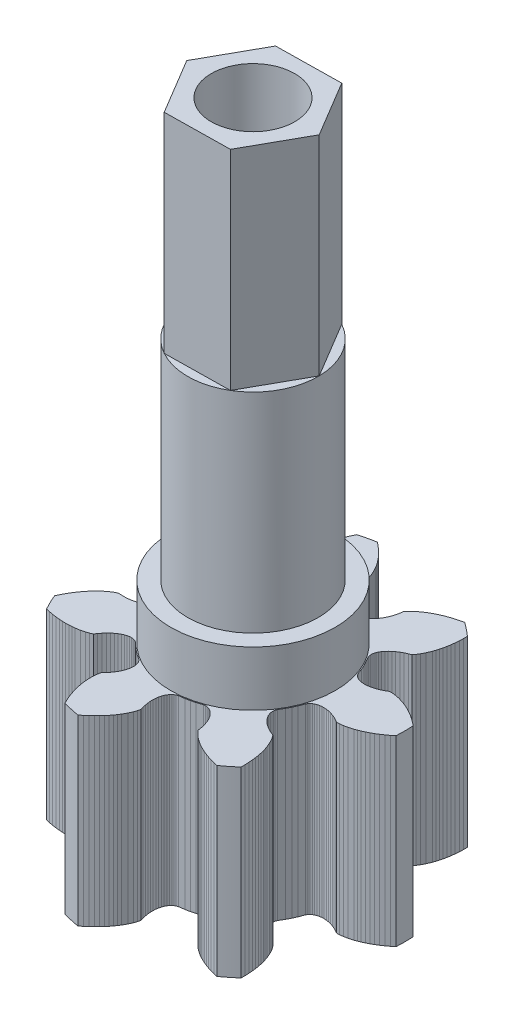
from build123d import *

# Parameters (mm, degrees)
SKETCH1_R           = 3.15
BOSS_EXTRUDE1_DEPTH = 2.1
SKETCH2_R           = 2.5
BOSS_EXTRUDE3_DEPTH = 16
BOSS_EXTRUDE4_DEPTH = 7
SKETCH3_R           = 1.1
SKETCH3_R_2         = 0.75
CUT_EXTRUDE2_DEPTH  = 20.858328167
SKETCH6_R           = 1.7
CUT_EXTRUDE3_DEPTH  = 7.6
SKETCH7_R           = 1.6
CUT_EXTRUDE4_DEPTH  = 20.313031807
SKETCH8_OUTSIDE_W   = 19.149
SKETCH8_OUTSIDE_H   = 19.428
CUT_EXTRUDE5_DEPTH  = 8


with BuildPart() as part:
    # Sketch1 → Boss-Extrude1 (new body)
    with BuildSketch(Plane(origin=(0, 0, 0), x_dir=(1, 0, 0), z_dir=(0, 1, 0))):
        with Locations(Location((0, 0, 0), (0, 0, 270))):
            Circle(SKETCH1_R)
    extrude(amount=BOSS_EXTRUDE1_DEPTH)

    # Sketch2 → Boss-Extrude3 (add)
    with BuildSketch(Plane(origin=(0, 2.1, 0), x_dir=(1, 0, 0), z_dir=(0, 1, 0))):
        with Locations(Location((0, 0, 0), (0, 0, 270))):
            Circle(SKETCH2_R)
    extrude(amount=BOSS_EXTRUDE3_DEPTH)

    # Sketch4 → Boss-Extrude4 (add)
    with BuildSketch(Plane.XZ):
        with BuildLine():
            Line((-1.677656104, -5.457545802), (-1.740166904, -5.314388502))
            Line((-1.740166904, -5.314388502), (-1.793915704, -5.175673402))
            Line((-1.793915704, -5.175673402), (-1.839244704, -5.042342702))
            Line((-1.839244704, -5.042342702), (-1.876421604, -4.915999102))
            Line((-1.876421604, -4.915999102), (-1.907053904, -4.793237402))
            Line((-1.907053904, -4.793237402), (-1.931099704, -4.676009702))
            Line((-1.931099704, -4.676009702), (-1.948773704, -4.566830802))
            Line((-1.948773704, -4.566830802), (-1.961024804, -4.464035702))
            Line((-1.961024804, -4.464035702), (-1.971502404, -4.279785302))
            Line((-1.971502404, -4.279785302), (-1.967365804, -4.124635702))
            Line((-1.967365804, -4.124635702), (-1.953730504, -4.000928102))
            Line((-1.953730504, -4.000928102), (-1.930260404, -3.886700602))
            Line((-1.930260404, -3.886700602), (-1.859391804, -3.809735002))
            Line((-1.859391804, -3.809735002), (-1.778417204, -3.712510502))
            Line((-1.778417204, -3.712510502), (-1.708697804, -3.615493902))
            Line((-1.708697804, -3.615493902), (-1.650076104, -3.519450202))
            Line((-1.650076104, -3.519450202), (-1.602332404, -3.425130202))
            Line((-1.602332404, -3.425130202), (-1.565200104, -3.333258302))
            Line((-1.565200104, -3.333258302), (-1.538382904, -3.244569502))
            Line((-1.538382904, -3.244569502), (-1.521548504, -3.159737902))
            Line((-1.521548504, -3.159737902), (-1.514299404, -3.079451802))
            Line((-1.514299404, -3.079451802), (-1.516222204, -3.004347502))
            Line((-1.516222204, -3.004347502), (-1.526863004, -2.935043002))
            Line((-1.526863004, -2.935043002), (-1.545721204, -2.872129302))
            Line((-1.545721204, -2.872129302), (-1.572279104, -2.816160102))
            Line((-1.572279104, -2.816160102), (-1.605971904, -2.767662302))
            Line((-1.605971904, -2.767662302), (-1.657232504, -2.718290402))
            Line((-1.657232504, -2.718290402), (-1.844744204, -2.592775302))
            Line((-1.844744204, -2.592775302), (-1.984007204, -2.487817902))
            Line((-1.984007204, -2.487817902), (-2.117322004, -2.375401802))
            Line((-2.117322004, -2.375401802), (-2.281415504, -2.220521102))
            Line((-2.281415504, -2.220521102), (-2.340956004, -2.181532002))
            Line((-2.340956004, -2.181532002), (-2.395735304, -2.159475702))
            Line((-2.395735304, -2.159475702), (-2.456210904, -2.146038102))
            Line((-2.456210904, -2.146038102), (-2.521743604, -2.141652302))
            Line((-2.521743604, -2.141652302), (-2.591678304, -2.146699902))
            Line((-2.591678304, -2.146699902), (-2.665327304, -2.161537602))
            Line((-2.665327304, -2.161537602), (-2.741987504, -2.186470302))
            Line((-2.741987504, -2.186470302), (-2.820946104, -2.221759402))
            Line((-2.820946104, -2.221759402), (-2.901443904, -2.267639402))
            Line((-2.901443904, -2.267639402), (-2.982749704, -2.324284202))
            Line((-2.982749704, -2.324284202), (-3.064080904, -2.391819002))
            Line((-3.064080904, -2.391819002), (-3.144672004, -2.470342602))
            Line((-3.144672004, -2.470342602), (-3.223742204, -2.559902302))
            Line((-3.223742204, -2.559902302), (-3.300510504, -2.660481102))
            Line((-3.300510504, -2.660481102), (-3.359776704, -2.746699402))
            Line((-3.359776704, -2.746699402), (-3.465917704, -2.794999002))
            Line((-3.465917704, -2.794999002), (-3.583489604, -2.835820002))
            Line((-3.583489604, -2.835820002), (-3.733828804, -2.874377002))
            Line((-3.733828804, -2.874377002), (-3.915791104, -2.905161502))
            Line((-3.915791104, -2.905161502), (-4.018735004, -2.916091602))
            Line((-4.018735004, -2.916091602), (-4.129109504, -2.923155402))
            Line((-4.129109504, -2.923155402), (-4.248748704, -2.925798102))
            Line((-4.248748704, -2.925798102), (-4.375248804, -2.923250802))
            Line((-4.375248804, -2.923250802), (-4.506697404, -2.915120202))
            Line((-4.506697404, -2.915120202), (-4.646771904, -2.900596502))
            Line((-4.646771904, -2.900596502), (-4.793969404, -2.879062302))
            Line((-4.793969404, -2.879062302), (-4.947447304, -2.849974302))
            Line((-4.947447304, -2.849974302), (-5.090225304, -2.816749202))
            ThreePointArc((-5.090225304, -2.816749202), (-5.241476502, -2.524161997), (-5.375926806, -2.223483907))
            Line((-5.375926806, -2.223483907), (-5.312882596, -2.091140098))
            Line((-5.312882596, -2.091140098), (-5.239932596, -1.953010098))
            Line((-5.239932596, -1.953010098), (-5.164992596, -1.824500098))
            Line((-5.164992596, -1.824500098), (-5.089012596, -1.705930098))
            Line((-5.089012596, -1.705930098), (-5.013412596, -1.598090098))
            Line((-5.013412596, -1.598090098), (-4.936532596, -1.497600098))
            Line((-4.936532596, -1.497600098), (-4.859872596, -1.405710098))
            Line((-4.859872596, -1.405710098), (-4.785532596, -1.323820098))
            Line((-4.785532596, -1.323820098), (-4.712802596, -1.250150098))
            Line((-4.712802596, -1.250150098), (-4.575282596, -1.127080098))
            Line((-4.575282596, -1.127080098), (-4.451402596, -1.033580098))
            Line((-4.451402596, -1.033580098), (-4.346182596, -0.967110098))
            Line((-4.346182596, -0.967110098), (-4.242242596, -0.914240098))
            Line((-4.242242596, -0.914240098), (-4.137882596, -0.921660098))
            Line((-4.137882596, -0.921660098), (-4.011382596, -0.924350098))
            Line((-4.011382596, -0.924350098), (-3.892062596, -0.918370098))
            Line((-3.892062596, -0.918370098), (-3.780422596, -0.904320098))
            Line((-3.780422596, -0.904320098), (-3.676912596, -0.882840098))
            Line((-3.676912596, -0.882840098), (-3.581932596, -0.854590098))
            Line((-3.581932596, -0.854590098), (-3.495872596, -0.820260098))
            Line((-3.495872596, -0.820260098), (-3.419052596, -0.780530098))
            Line((-3.419052596, -0.780530098), (-3.351762596, -0.736140098))
            Line((-3.351762596, -0.736140098), (-3.294242596, -0.687810098))
            Line((-3.294242596, -0.687810098), (-3.246692596, -0.636280098))
            Line((-3.246692596, -0.636280098), (-3.209262596, -0.582310098))
            Line((-3.209262596, -0.582310098), (-3.182062596, -0.526650098))
            Line((-3.182062596, -0.526650098), (-3.165152596, -0.470070098))
            Line((-3.165152596, -0.470070098), (-3.158512596, -0.399210098))
            Line((-3.158512596, -0.399210098), (-3.177292596, -0.174350098))
            Line((-3.177292596, -0.174350098), (-3.182062596, -3.0098e-05))
            Line((-3.182062596, -3.0098e-05), (-3.177292596, 0.174289902))
            Line((-3.177292596, 0.174289902), (-3.158512596, 0.399149902))
            Line((-3.158512596, 0.399149902), (-3.165152596, 0.470009902))
            Line((-3.165152596, 0.470009902), (-3.182062596, 0.526589902))
            Line((-3.182062596, 0.526589902), (-3.209262596, 0.582249902))
            Line((-3.209262596, 0.582249902), (-3.246692596, 0.636219902))
            Line((-3.246692596, 0.636219902), (-3.294242596, 0.687749902))
            Line((-3.294242596, 0.687749902), (-3.351762596, 0.736079902))
            Line((-3.351762596, 0.736079902), (-3.419052596, 0.780469902))
            Line((-3.419052596, 0.780469902), (-3.495872596, 0.820199902))
            Line((-3.495872596, 0.820199902), (-3.581932596, 0.854529902))
            Line((-3.581932596, 0.854529902), (-3.676912596, 0.882779902))
            Line((-3.676912596, 0.882779902), (-3.780422596, 0.904259902))
            Line((-3.780422596, 0.904259902), (-3.892062596, 0.918309902))
            Line((-3.892062596, 0.918309902), (-4.011382596, 0.924289902))
            Line((-4.011382596, 0.924289902), (-4.137882596, 0.921599902))
            Line((-4.137882596, 0.921599902), (-4.242242596, 0.914179902))
            Line((-4.242242596, 0.914179902), (-4.346182596, 0.967049902))
            Line((-4.346182596, 0.967049902), (-4.451402596, 1.033519902))
            Line((-4.451402596, 1.033519902), (-4.575282596, 1.127019902))
            Line((-4.575282596, 1.127019902), (-4.712802596, 1.250089902))
            Line((-4.712802596, 1.250089902), (-4.785532596, 1.323759902))
            Line((-4.785532596, 1.323759902), (-4.859872596, 1.405649902))
            Line((-4.859872596, 1.405649902), (-4.936532596, 1.497539902))
            Line((-4.936532596, 1.497539902), (-5.013412596, 1.598029902))
            Line((-5.013412596, 1.598029902), (-5.089012596, 1.705869902))
            Line((-5.089012596, 1.705869902), (-5.164992596, 1.824439902))
            Line((-5.164992596, 1.824439902), (-5.239932596, 1.952949902))
            Line((-5.239932596, 1.952949902), (-5.312882596, 2.091079902))
            Line((-5.312882596, 2.091079902), (-5.375926796, 2.223423702))
            ThreePointArc((-5.375926796, 2.223423702), (-5.241476491, 2.524101771), (-5.090225294, 2.816688957))
            Line((-5.090225294, 2.816688957), (-4.947447286, 2.849914054))
            Line((-4.947447286, 2.849914054), (-4.793969386, 2.879002054))
            Line((-4.793969386, 2.879002054), (-4.646771886, 2.900536254))
            Line((-4.646771886, 2.900536254), (-4.506697386, 2.915059954))
            Line((-4.506697386, 2.915059954), (-4.375248786, 2.923190554))
            Line((-4.375248786, 2.923190554), (-4.248748686, 2.925737854))
            Line((-4.248748686, 2.925737854), (-4.129109486, 2.923095154))
            Line((-4.129109486, 2.923095154), (-4.018734986, 2.916031354))
            Line((-4.018734986, 2.916031354), (-3.915791086, 2.905101254))
            Line((-3.915791086, 2.905101254), (-3.733828786, 2.874316754))
            Line((-3.733828786, 2.874316754), (-3.583489586, 2.835759754))
            Line((-3.583489586, 2.835759754), (-3.465917686, 2.794938754))
            Line((-3.465917686, 2.794938754), (-3.359776686, 2.746639154))
            Line((-3.359776686, 2.746639154), (-3.300510486, 2.660420854))
            Line((-3.300510486, 2.660420854), (-3.223742186, 2.559842054))
            Line((-3.223742186, 2.559842054), (-3.144671986, 2.470282354))
            Line((-3.144671986, 2.470282354), (-3.064080886, 2.391758754))
            Line((-3.064080886, 2.391758754), (-2.982749686, 2.324223954))
            Line((-2.982749686, 2.324223954), (-2.901443886, 2.267579154))
            Line((-2.901443886, 2.267579154), (-2.820946086, 2.221699154))
            Line((-2.820946086, 2.221699154), (-2.741987486, 2.186410054))
            Line((-2.741987486, 2.186410054), (-2.665327286, 2.161477354))
            Line((-2.665327286, 2.161477354), (-2.591678286, 2.146639654))
            Line((-2.591678286, 2.146639654), (-2.521743586, 2.141592054))
            Line((-2.521743586, 2.141592054), (-2.456210886, 2.145977854))
            Line((-2.456210886, 2.145977854), (-2.395735286, 2.159415454))
            Line((-2.395735286, 2.159415454), (-2.340955986, 2.181471754))
            Line((-2.340955986, 2.181471754), (-2.281415486, 2.220460854))
            Line((-2.281415486, 2.220460854), (-2.117321986, 2.375341554))
            Line((-2.117321986, 2.375341554), (-1.984007186, 2.487757654))
            Line((-1.984007186, 2.487757654), (-1.844744186, 2.592715054))
            Line((-1.844744186, 2.592715054), (-1.657232486, 2.718230154))
            Line((-1.657232486, 2.718230154), (-1.605971886, 2.767602054))
            Line((-1.605971886, 2.767602054), (-1.572279086, 2.816099854))
            Line((-1.572279086, 2.816099854), (-1.545721186, 2.872069054))
            Line((-1.545721186, 2.872069054), (-1.526862986, 2.934982754))
            Line((-1.526862986, 2.934982754), (-1.516222186, 3.004287254))
            Line((-1.516222186, 3.004287254), (-1.514299386, 3.079391554))
            Line((-1.514299386, 3.079391554), (-1.521548486, 3.159677654))
            Line((-1.521548486, 3.159677654), (-1.538382886, 3.244509254))
            Line((-1.538382886, 3.244509254), (-1.565200086, 3.333198054))
            Line((-1.565200086, 3.333198054), (-1.602332386, 3.425069954))
            Line((-1.602332386, 3.425069954), (-1.650076086, 3.519389954))
            Line((-1.650076086, 3.519389954), (-1.708697786, 3.615433654))
            Line((-1.708697786, 3.615433654), (-1.778417186, 3.712450254))
            Line((-1.778417186, 3.712450254), (-1.859391786, 3.809674754))
            Line((-1.859391786, 3.809674754), (-1.930260386, 3.886640354))
            Line((-1.930260386, 3.886640354), (-1.953730486, 4.000867854))
            Line((-1.953730486, 4.000867854), (-1.967365786, 4.124575454))
            Line((-1.967365786, 4.124575454), (-1.971502386, 4.279725054))
            Line((-1.971502386, 4.279725054), (-1.961024786, 4.463975454))
            Line((-1.961024786, 4.463975454), (-1.948773686, 4.566770554))
            Line((-1.948773686, 4.566770554), (-1.931099686, 4.675949454))
            Line((-1.931099686, 4.675949454), (-1.907053886, 4.793177154))
            Line((-1.907053886, 4.793177154), (-1.876421586, 4.915938854))
            Line((-1.876421586, 4.915938854), (-1.839244686, 5.042282454))
            Line((-1.839244686, 5.042282454), (-1.793915686, 5.175613154))
            Line((-1.793915686, 5.175613154), (-1.740166886, 5.314328254))
            Line((-1.740166886, 5.314328254), (-1.677656086, 5.457485554))
            Line((-1.677656086, 5.457485554), (-1.613492886, 5.589290554))
            ThreePointArc((-1.613492886, 5.589290554), (-1.294584924, 5.671642777), (-0.971527485, 5.735814951))
            Line((-0.971527485, 5.735814951), (-0.856530379, 5.644902123))
            Line((-0.856530379, 5.644902123), (-0.738096579, 5.543044323))
            Line((-0.738096579, 5.543044323), (-0.629484279, 5.441387023))
            Line((-0.629484279, 5.441387023), (-0.530794179, 5.340927723))
            Line((-0.530794179, 5.340927723), (-0.442480579, 5.243226523))
            Line((-0.442480579, 5.243226523), (-0.361617479, 5.145912923))
            Line((-0.361617479, 5.145912923), (-0.289089779, 5.050727423))
            Line((-0.289089779, 5.050727423), (-0.225795179, 4.960029123))
            Line((-0.225795179, 4.960029123), (-0.170156179, 4.872729423))
            Line((-0.170156179, 4.872729423), (-0.080772879, 4.711271723))
            Line((-0.080772879, 4.711271723), (-0.017182979, 4.569691923))
            Line((-0.017182979, 4.569691923), (0.024206821, 4.452319023))
            Line((0.024206821, 4.452319023), (0.052622421, 4.339220423))
            Line((0.052622421, 4.339220423), (0.022166221, 4.239128023))
            Line((0.022166221, 4.239128023), (-0.008605279, 4.116398223))
            Line((-0.008605279, 4.116398223), (-0.029326379, 3.998739123))
            Line((-0.029326379, 3.998739123), (-0.040470879, 3.886771723))
            Line((-0.040470879, 3.886771723), (-0.042562579, 3.781077223))
            Line((-0.042562579, 3.781077223), (-0.036155879, 3.682192323))
            Line((-0.036155879, 3.682192323), (-0.021836779, 3.590650923))
            Line((-0.021836779, 3.590650923), (-0.000196979, 3.506916223))
            Line((-0.000196979, 3.506916223), (0.028106621, 3.431435623))
            Line((0.028106621, 3.431435623), (0.062425521, 3.364603323))
            Line((0.062425521, 3.364603323), (0.102082621, 3.306779023))
            Line((0.102082621, 3.306779023), (0.146370621, 3.258277923))
            Line((0.146370621, 3.258277923), (0.194582521, 3.219374423))
            Line((0.194582521, 3.219374423), (0.245981121, 3.190298123))
            Line((0.245981121, 3.190298123), (0.313586921, 3.168056823))
            Line((0.313586921, 3.168056823), (0.536988121, 3.136329923))
            Line((0.536988121, 3.136329923), (0.707999021, 3.102190423))
            Line((0.707999021, 3.102190423), (0.876887021, 3.058750223))
            Line((0.876887021, 3.058750223), (1.091930421, 2.990405023))
            Line((1.091930421, 2.990405023), (1.162491321, 2.981110623))
            Line((1.162491321, 2.981110623), (1.221415521, 2.985006423))
            Line((1.221415521, 2.985006423), (1.281732621, 2.999139023))
            Line((1.281732621, 2.999139023), (1.342678421, 3.023621123))
            Line((1.342678421, 3.023621123), (1.403497321, 3.058512423))
            Line((1.403497321, 3.058512423), (1.463415021, 3.103835823))
            Line((1.463415021, 3.103835823), (1.521665521, 3.159561023))
            Line((1.521665521, 3.159561023), (1.577493421, 3.225614223))
            Line((1.577493421, 3.225614223), (1.630112821, 3.301877423))
            Line((1.630112821, 3.301877423), (1.678789621, 3.388189823))
            Line((1.678789621, 3.388189823), (1.722764221, 3.484324823))
            Line((1.722764221, 3.484324823), (1.761304221, 3.590039423))
            Line((1.761304221, 3.590039423), (1.793685421, 3.705037123))
            Line((1.793685421, 3.705037123), (1.819211821, 3.828964023))
            Line((1.819211821, 3.828964023), (1.835200121, 3.932358623))
            Line((1.835200121, 3.932358623), (1.909873421, 4.021928023))
            Line((1.909873421, 4.021928023), (1.998090521, 4.109718923))
            Line((1.998090521, 4.109718923), (2.116812121, 4.209687323))
            Line((2.116812121, 4.209687323), (2.267397621, 4.316373723))
            Line((2.267397621, 4.316373723), (2.355404521, 4.370887123))
            Line((2.355404521, 4.370887123), (2.451783521, 4.425141023))
            Line((2.451783521, 4.425141023), (2.558428121, 4.479431523))
            Line((2.558428121, 4.479431523), (2.673506021, 4.532022823))
            Line((2.673506021, 4.532022823), (2.795464821, 4.581730723))
            Line((2.795464821, 4.581730723), (2.927969221, 4.629421523))
            Line((2.927969221, 4.629421523), (3.069932921, 4.673886423))
            Line((3.069932921, 4.673886423), (3.220832621, 4.714270623))
            Line((3.220832621, 4.714270623), (3.363886921, 4.746284823))
            ThreePointArc((3.363886921, 4.746284823), (3.627108363, 4.548298309), (3.878703226, 4.335732528))
            Line((3.878703226, 4.335732528), (3.879324236, 4.189141042))
            Line((3.879324236, 4.189141042), (3.873530936, 4.033038442))
            Line((3.873530936, 4.033038442), (3.861770736, 3.884739642))
            Line((3.861770736, 3.884739642), (3.844760636, 3.744945242))
            Line((3.844760636, 3.744945242), (3.823437436, 3.614983242))
            Line((3.823437436, 3.614983242), (3.797771936, 3.491087842))
            Line((3.797771936, 3.491087842), (3.768573236, 3.375036342))
            Line((3.768573236, 3.375036342), (3.737125936, 3.269001042))
            Line((3.737125936, 3.269001042), (3.703562736, 3.171070342))
            Line((3.703562736, 3.171070342), (3.633059536, 3.000520342))
            Line((3.633059536, 3.000520342), (3.562015636, 2.862530242))
            Line((3.562015636, 2.862530242), (3.496055936, 2.756989642))
            Line((3.496055936, 2.756989642), (3.425348736, 2.664257542))
            Line((3.425348736, 2.664257542), (3.328104136, 2.625662642))
            Line((3.328104136, 2.625662642), (3.212964436, 2.573199942))
            Line((3.212964436, 2.573199942), (3.108055436, 2.516041142))
            Line((3.108055436, 2.516041142), (3.013567336, 2.454943742))
            Line((3.013567336, 2.454943742), (2.929627936, 2.390679642))
            Line((2.929627936, 2.390679642), (2.856311136, 2.324016942))
            Line((2.856311136, 2.324016942), (2.793668936, 2.255746642))
            Line((2.793668936, 2.255746642), (2.741694736, 2.186620242))
            Line((2.741694736, 2.186620242), (2.700328636, 2.117430142))
            Line((2.700328636, 2.117430142), (2.669474536, 2.048929342))
            Line((2.669474536, 2.048929342), (2.648991436, 1.981871242))
            Line((2.648991436, 1.981871242), (2.638684936, 1.917005642))
            Line((2.638684936, 1.917005642), (2.638328536, 1.855056142))
            Line((2.638328536, 1.855056142), (2.647642236, 1.796742342))
            Line((2.647642236, 1.796742342), (2.672404836, 1.730018642))
            Line((2.672404836, 1.730018642), (2.786888136, 1.535575142))
            Line((2.786888136, 1.535575142), (2.866820336, 1.380587942))
            Line((2.866820336, 1.380587942), (2.938157336, 1.221461342))
            Line((2.938157336, 1.221461342), (3.018800236, 1.010721142))
            Line((3.018800236, 1.010721142), (3.055527736, 0.949759542))
            Line((3.055527736, 0.949759542), (3.095312236, 0.906119642))
            Line((3.095312236, 0.906119642), (3.143968536, 0.867773342))
            Line((3.143968536, 0.867773342), (3.201108536, 0.835388342))
            Line((3.201108536, 0.835388342), (3.266307636, 0.809592642))
            Line((3.266307636, 0.809592642), (3.339100936, 0.791005742))
            Line((3.339100936, 0.791005742), (3.418987236, 0.780207842))
            Line((3.418987236, 0.780207842), (3.505437836, 0.777743242))
            Line((3.505437836, 0.777743242), (3.597870436, 0.784153042))
            Line((3.597870436, 0.784153042), (3.695701736, 0.799910942))
            Line((3.695701736, 0.799910942), (3.798280836, 0.825469442))
            Line((3.798280836, 0.825469442), (3.904961036, 0.861249642))
            Line((3.904961036, 0.861249642), (4.015059336, 0.907632842))
            Line((4.015059336, 0.907632842), (4.127864736, 0.964942742))
            Line((4.127864736, 0.964942742), (4.218670436, 1.016908042))
            Line((4.218670436, 1.016908042), (4.335256536, 1.014371642))
            Line((4.335256536, 1.014371642), (4.458896736, 1.000137542))
            Line((4.458896736, 1.000137542), (4.611076836, 0.969646442))
            Line((4.611076836, 0.969646442), (4.788376236, 0.918431942))
            Line((4.788376236, 0.918431942), (4.885867836, 0.883613842))
            Line((4.885867836, 0.883613842), (4.988376636, 0.842088442))
            Line((4.988376636, 0.842088442), (5.097314536, 0.792559942))
            Line((5.097314536, 0.792559942), (5.210181936, 0.735378542))
            Line((5.210181936, 0.735378542), (5.325085236, 0.671019742))
            Line((5.325085236, 0.671019742), (5.444986436, 0.597158342))
            Line((5.444986436, 0.597158342), (5.568263436, 0.513890042))
            Line((5.568263436, 0.513890042), (5.693921436, 0.421091042))
            Line((5.693921436, 0.421091042), (5.808144136, 0.329207242))
            ThreePointArc((5.808144136, 0.329207242), (5.817467929, -3.016e-05), (5.808144136, -0.329267562))
            Line((5.808144136, -0.329267562), (5.693921429, -0.421151358))
            Line((5.693921429, -0.421151358), (5.568263429, -0.513950358))
            Line((5.568263429, -0.513950358), (5.444986429, -0.597218658))
            Line((5.444986429, -0.597218658), (5.325085229, -0.671080058))
            Line((5.325085229, -0.671080058), (5.210181929, -0.735438858))
            Line((5.210181929, -0.735438858), (5.097314529, -0.792620258))
            Line((5.097314529, -0.792620258), (4.988376629, -0.842148758))
            Line((4.988376629, -0.842148758), (4.885867829, -0.883674158))
            Line((4.885867829, -0.883674158), (4.788376229, -0.918492258))
            Line((4.788376229, -0.918492258), (4.611076829, -0.969706758))
            Line((4.611076829, -0.969706758), (4.458896729, -1.000197858))
            Line((4.458896729, -1.000197858), (4.335256529, -1.014431958))
            Line((4.335256529, -1.014431958), (4.218670429, -1.016968358))
            Line((4.218670429, -1.016968358), (4.127864729, -0.965003058))
            Line((4.127864729, -0.965003058), (4.015059329, -0.907693158))
            Line((4.015059329, -0.907693158), (3.904961029, -0.861309958))
            Line((3.904961029, -0.861309958), (3.798280829, -0.825529758))
            Line((3.798280829, -0.825529758), (3.695701729, -0.799971258))
            Line((3.695701729, -0.799971258), (3.597870429, -0.784213358))
            Line((3.597870429, -0.784213358), (3.505437829, -0.777803558))
            Line((3.505437829, -0.777803558), (3.418987229, -0.780268158))
            Line((3.418987229, -0.780268158), (3.339100929, -0.791066058))
            Line((3.339100929, -0.791066058), (3.266307629, -0.809652958))
            Line((3.266307629, -0.809652958), (3.201108529, -0.835448658))
            Line((3.201108529, -0.835448658), (3.143968529, -0.867833658))
            Line((3.143968529, -0.867833658), (3.095312229, -0.906179958))
            Line((3.095312229, -0.906179958), (3.055527729, -0.949819858))
            Line((3.055527729, -0.949819858), (3.018800229, -1.010781458))
            Line((3.018800229, -1.010781458), (2.938157329, -1.221521658))
            Line((2.938157329, -1.221521658), (2.866820329, -1.380648258))
            Line((2.866820329, -1.380648258), (2.786888129, -1.535635458))
            Line((2.786888129, -1.535635458), (2.672404829, -1.730078958))
            Line((2.672404829, -1.730078958), (2.647642229, -1.796802658))
            Line((2.647642229, -1.796802658), (2.638328529, -1.855116458))
            Line((2.638328529, -1.855116458), (2.638684929, -1.917065958))
            Line((2.638684929, -1.917065958), (2.648991429, -1.981931558))
            Line((2.648991429, -1.981931558), (2.669474529, -2.048989658))
            Line((2.669474529, -2.048989658), (2.700328629, -2.117490458))
            Line((2.700328629, -2.117490458), (2.741694729, -2.186680558))
            Line((2.741694729, -2.186680558), (2.793668929, -2.255806958))
            Line((2.793668929, -2.255806958), (2.856311129, -2.324077258))
            Line((2.856311129, -2.324077258), (2.929627929, -2.390739958))
            Line((2.929627929, -2.390739958), (3.013567329, -2.455004058))
            Line((3.013567329, -2.455004058), (3.108055429, -2.516101458))
            Line((3.108055429, -2.516101458), (3.212964429, -2.573260258))
            Line((3.212964429, -2.573260258), (3.328104129, -2.625722958))
            Line((3.328104129, -2.625722958), (3.425348729, -2.664317858))
            Line((3.425348729, -2.664317858), (3.496055929, -2.757049958))
            Line((3.496055929, -2.757049958), (3.562015629, -2.862590558))
            Line((3.562015629, -2.862590558), (3.633059529, -3.000580658))
            Line((3.633059529, -3.000580658), (3.703562729, -3.171130658))
            Line((3.703562729, -3.171130658), (3.737125929, -3.269061358))
            Line((3.737125929, -3.269061358), (3.768573229, -3.375096658))
            Line((3.768573229, -3.375096658), (3.797771929, -3.491148158))
            Line((3.797771929, -3.491148158), (3.823437429, -3.615043558))
            Line((3.823437429, -3.615043558), (3.844760629, -3.745005558))
            Line((3.844760629, -3.745005558), (3.861770729, -3.884799958))
            Line((3.861770729, -3.884799958), (3.873530929, -4.033098758))
            Line((3.873530929, -4.033098758), (3.879324229, -4.189201358))
            Line((3.879324229, -4.189201358), (3.878703229, -4.335792858))
            ThreePointArc((3.878703229, -4.335792858), (3.627108367, -4.548358644), (3.363886927, -4.746345161))
            Line((3.363886927, -4.746345161), (3.220832594, -4.714330914))
            Line((3.220832594, -4.714330914), (3.069932894, -4.673946714))
            Line((3.069932894, -4.673946714), (2.927969194, -4.629481814))
            Line((2.927969194, -4.629481814), (2.795464794, -4.581791014))
            Line((2.795464794, -4.581791014), (2.673505994, -4.532083114))
            Line((2.673505994, -4.532083114), (2.558428094, -4.479491814))
            Line((2.558428094, -4.479491814), (2.451783494, -4.425201314))
            Line((2.451783494, -4.425201314), (2.355404494, -4.370947414))
            Line((2.355404494, -4.370947414), (2.267397594, -4.316434014))
            Line((2.267397594, -4.316434014), (2.116812094, -4.209747614))
            Line((2.116812094, -4.209747614), (1.998090494, -4.109779214))
            Line((1.998090494, -4.109779214), (1.909873394, -4.021988314))
            Line((1.909873394, -4.021988314), (1.835200094, -3.932418914))
            Line((1.835200094, -3.932418914), (1.819211794, -3.829024314))
            Line((1.819211794, -3.829024314), (1.793685394, -3.705097414))
            Line((1.793685394, -3.705097414), (1.761304194, -3.590099714))
            Line((1.761304194, -3.590099714), (1.722764194, -3.484385114))
            Line((1.722764194, -3.484385114), (1.678789594, -3.388250114))
            Line((1.678789594, -3.388250114), (1.630112794, -3.301937714))
            Line((1.630112794, -3.301937714), (1.577493394, -3.225674514))
            Line((1.577493394, -3.225674514), (1.521665494, -3.159621314))
            Line((1.521665494, -3.159621314), (1.463414994, -3.103896114))
            Line((1.463414994, -3.103896114), (1.403497294, -3.058572714))
            Line((1.403497294, -3.058572714), (1.342678394, -3.023681414))
            Line((1.342678394, -3.023681414), (1.281732594, -2.999199314))
            Line((1.281732594, -2.999199314), (1.221415494, -2.985066714))
            Line((1.221415494, -2.985066714), (1.162491294, -2.981170914))
            Line((1.162491294, -2.981170914), (1.091930394, -2.990465314))
            Line((1.091930394, -2.990465314), (0.876886994, -3.058810514))
            Line((0.876886994, -3.058810514), (0.707998994, -3.102250714))
            Line((0.707998994, -3.102250714), (0.536988094, -3.136390214))
            Line((0.536988094, -3.136390214), (0.313586894, -3.168117114))
            Line((0.313586894, -3.168117114), (0.245981094, -3.190358414))
            Line((0.245981094, -3.190358414), (0.194582494, -3.219434714))
            Line((0.194582494, -3.219434714), (0.146370594, -3.258338214))
            Line((0.146370594, -3.258338214), (0.102082594, -3.306839314))
            Line((0.102082594, -3.306839314), (0.062425494, -3.364663614))
            Line((0.062425494, -3.364663614), (0.028106594, -3.431495914))
            Line((0.028106594, -3.431495914), (-0.000197006, -3.506976514))
            Line((-0.000197006, -3.506976514), (-0.021836806, -3.590711214))
            Line((-0.021836806, -3.590711214), (-0.036155906, -3.682252614))
            Line((-0.036155906, -3.682252614), (-0.042562606, -3.781137514))
            Line((-0.042562606, -3.781137514), (-0.040470906, -3.886832014))
            Line((-0.040470906, -3.886832014), (-0.029326406, -3.998799414))
            Line((-0.029326406, -3.998799414), (-0.008605306, -4.116458514))
            Line((-0.008605306, -4.116458514), (0.022166194, -4.239188314))
            Line((0.022166194, -4.239188314), (0.052622394, -4.339280714))
            Line((0.052622394, -4.339280714), (0.024206794, -4.452379314))
            Line((0.024206794, -4.452379314), (-0.017183006, -4.569752214))
            Line((-0.017183006, -4.569752214), (-0.080772906, -4.711332014))
            Line((-0.080772906, -4.711332014), (-0.170156206, -4.872789714))
            Line((-0.170156206, -4.872789714), (-0.225795206, -4.960089414))
            Line((-0.225795206, -4.960089414), (-0.289089806, -5.050787714))
            Line((-0.289089806, -5.050787714), (-0.361617506, -5.145973214))
            Line((-0.361617506, -5.145973214), (-0.442480606, -5.243286814))
            Line((-0.442480606, -5.243286814), (-0.530794206, -5.340988014))
            Line((-0.530794206, -5.340988014), (-0.629484306, -5.441447314))
            Line((-0.629484306, -5.441447314), (-0.738096606, -5.543104614))
            Line((-0.738096606, -5.543104614), (-0.856530406, -5.644962414))
            Line((-0.856530406, -5.644962414), (-0.971527506, -5.735875214))
            ThreePointArc((-0.971527506, -5.735875214), (-1.294584942, -5.671703035), (-1.613492901, -5.589350807))
            Line((-1.613492901, -5.589350807), (-1.677656104, -5.457545802))
        make_face()
    extrude(amount=BOSS_EXTRUDE4_DEPTH)

    # Sketch3 → Cut-Extrude2 (cut, through all)
    # profile 1 of 2: a face of its own
    with BuildSketch(Plane.XZ):
        with Locations(Location((0, 0, 0), (0, 0, 90))):
            Circle(SKETCH3_R)
        Circle(SKETCH3_R_2, mode=Mode.SUBTRACT)
    # profile 2 of 2: a face of its own
    with BuildSketch(Plane.XZ):
        Circle(SKETCH3_R_2)
    extrude(amount=CUT_EXTRUDE2_DEPTH, mode=Mode.SUBTRACT)

    # Sketch6 → Cut-Extrude3 (cut)
    with BuildSketch(Plane.XZ.offset(7)):
        with Locations(Location((0, 0, 0), (0, 0, 270))):
            Circle(SKETCH6_R)
    extrude(amount=-CUT_EXTRUDE3_DEPTH, mode=Mode.SUBTRACT)

    # Sketch7 → Cut-Extrude4 (cut, through all)
    with BuildSketch(Plane.XZ.offset(-0.6)):
        with Locations(Location((0, 0, 0), (0, 0, 270))):
            Circle(SKETCH7_R)
    extrude(amount=-CUT_EXTRUDE4_DEPTH, mode=Mode.SUBTRACT)

    # Sketch8 outside → Cut-Extrude5 (cut)
    with BuildSketch(Plane(origin=(0, 18.1, 0), x_dir=(1, 0, 0), z_dir=(0, 1, 0))):
        with Locations((0.2205, 0)):
            Rectangle(SKETCH8_OUTSIDE_W, SKETCH8_OUTSIDE_H)
        Polygon((1.282359789, -2.146055305), (2.499718306, 0.037528501), (1.217358518, 2.183583806), (-1.282359789, 2.146055305), (-2.499718306, -0.037528501), (-1.217358518, -2.183583806), align=None, mode=Mode.SUBTRACT)
    extrude(amount=-CUT_EXTRUDE5_DEPTH, mode=Mode.SUBTRACT)


solid = part.part
